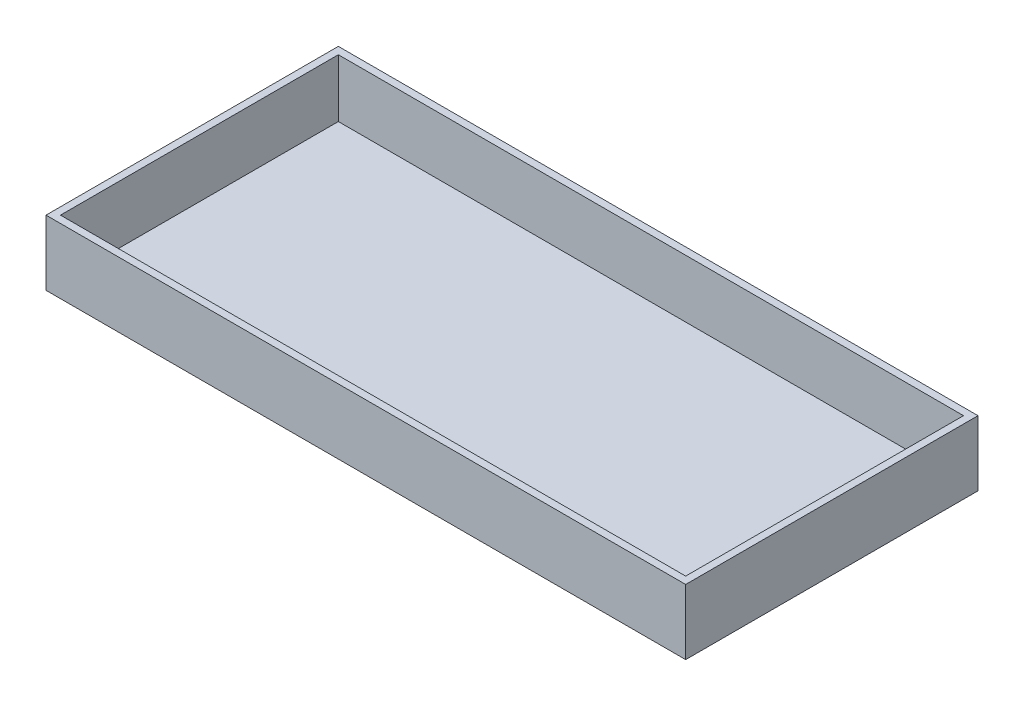
from build123d import *

# Parameters (mm, degrees)
SKETCH1_W           = 221
SKETCH1_H           = 101
SKETCH1_W_2         = 216
SKETCH1_H_2         = 96
BOSS_EXTRUDE1_DEPTH = 20
SKETCH1_3_W         = 221
SKETCH1_3_H         = 101
BOSS_EXTRUDE2_DEPTH = 2.5


with BuildPart() as part:
    # Sketch1 → Boss-Extrude1 (new body)
    with BuildSketch(Plane(origin=(0, 0, 0), x_dir=(1, 0, 0), z_dir=(0, 1, 0))):
        Rectangle(SKETCH1_W, SKETCH1_H)
        Rectangle(SKETCH1_W_2, SKETCH1_H_2, mode=Mode.SUBTRACT)
    extrude(amount=BOSS_EXTRUDE1_DEPTH)

    # Sketch1<3> → Boss-Extrude2 (add)
    with BuildSketch(Plane(origin=(0, 0, 0), x_dir=(1, 0, 0), z_dir=(0, 1, 0))):
        Rectangle(SKETCH1_3_W, SKETCH1_3_H)
    extrude(amount=-BOSS_EXTRUDE2_DEPTH)


solid = part.part
